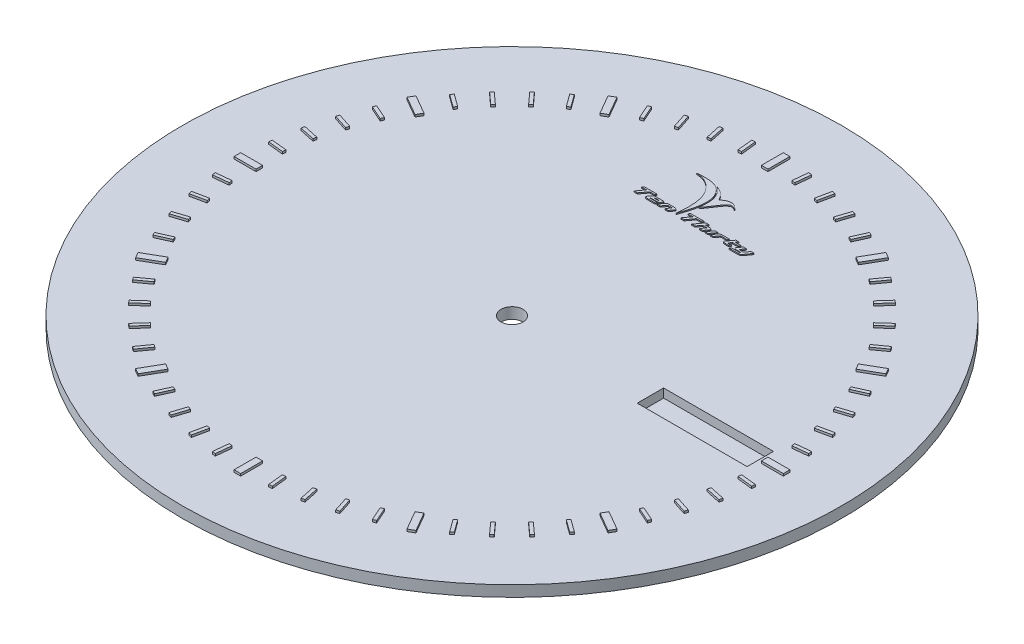
from build123d import *

# Parameters (mm, degrees)
SKETCH1_R         = 15
EXTRUDE1_DEPTH    = 0.5
SKETCH2_W         = 0.3
SKETCH2_H         = 1
EXTRUDE2_DEPTH    = 0.1
CIRPATTERN1_COUNT = 12
EXTRUDE3_DEPTH    = 0.1
CIRPATTERN2_COUNT = 60
SKETCH3_W         = 5
SKETCH3_H         = 1.2
EXTRUDE4_DEPTH    = 0.4
SKETCH4_R         = 0.5
EXTRUDE5_DEPTH    = 22.219095174
EXTRUDE6_DEPTH    = 0.05


# Read off the part's stored shape, not the designer's step: Extrude6
with BuildPart() as part:
    # Sketch1 → Extrude1 (new body)
    with BuildSketch(Plane(origin=(0, 0, 0), x_dir=(1, 0, 0), z_dir=(0, 1, 0))):
        with Locations(Location((0, 0, 0), (0, 0, 270))):
            Circle(SKETCH1_R)
    extrude(amount=EXTRUDE1_DEPTH)

    # Sketch2 → Extrude2 (add)
    with BuildSketch(Plane(origin=(0, 0.5, 0), x_dir=(1, 0, 0), z_dir=(0, 1, 0))):
        with Locations((0, 12)):
            Rectangle(SKETCH2_W, SKETCH2_H)
    extrude2 = extrude(amount=EXTRUDE2_DEPTH)

    # CirPattern1: Extrude2 ×12 about axis
    cirpattern1_axis = Axis((0, 0, 0), (0, 1, 0))
    for i in range(1, CIRPATTERN1_COUNT):
        add(extrude2.rotate(cirpattern1_axis, i * 360 / CIRPATTERN1_COUNT))

    # Sketch → Extrude3 (add)
    with BuildSketch(Plane(origin=(0, 0.5, 0), x_dir=(1, 0, 0), z_dir=(0, 1, 0))):
        Polygon((1.365515664, 12.274505773), (1.292345739, 11.578340446), (1.143167455, 11.594019716), (1.216337379, 12.290185043), align=None)
    extrude3 = extrude(amount=EXTRUDE3_DEPTH)

    # CirPattern2: Extrude3 ×60 about axis, 12 skipped
    cirpattern2_axis = Axis((0, 0, 0), (0, -1, 0))
    add([extrude3.rotate(cirpattern2_axis, i * 360 / CIRPATTERN2_COUNT) for i in range(1, CIRPATTERN2_COUNT) if i not in (4, 9, 14, 19, 24, 29, 34, 39, 44, 49, 54, 59)])

    # Sketch3 → Extrude4 (cut)
    with BuildSketch(Plane(origin=(0, 0.5, 0), x_dir=(1, 0, 0), z_dir=(0, 1, 0))):
        with Locations((8.8, 0)):
            Rectangle(SKETCH3_W, SKETCH3_H)
    extrude(amount=-EXTRUDE4_DEPTH, mode=Mode.SUBTRACT)

    # Sketch4 → Extrude5 (cut, through all)
    with BuildSketch(Plane(origin=(0, 0.5, 0), x_dir=(1, 0, 0), z_dir=(0, 1, 0))):
        with Locations(Location((0, 0, 0), (0, 0, 270))):
            Circle(SKETCH4_R)
    extrude(amount=-EXTRUDE5_DEPTH, mode=Mode.SUBTRACT)

    # Extrude6 outline → Extrude6 (add)
    # profile 1 of 11: a face of its own
    with BuildSketch(Plane(origin=(0, 0.5, 0), x_dir=(1, 0, 0), z_dir=(0, 1, 0))):
        with BuildLine():
            Line((-1.090122481, 7.719047483), (-1.422168481, 7.719047483))
            add(Edge.make_bspline(
                [(-1.422168481, 7.719047483), (-1.436246281, 7.719047483), (-1.444743781, 7.719776783), (-1.447654381, 7.721232083)],
                knots=[0.842105263, 0.842105263, 0.842105263, 0.842105263, 0.894736842, 0.894736842, 0.894736842, 0.894736842], degree=3))
            Line((-1.447654381, 7.721232083), (-1.427992981, 7.746717983))
            Line((-1.427992981, 7.746717983), (-1.131629881, 7.746717983))
            add(Edge.make_bspline(
                [(-1.131629881, 7.746717983), (-1.090851781, 7.746717983), (-1.060996681, 7.758855383), (-1.042064581, 7.783126883)],
                knots=[0.052631579, 0.052631579, 0.052631579, 0.052631579, 0.105263158, 0.105263158, 0.105263158, 0.105263158], degree=3))
            Line((-1.042064581, 7.783126883), (-0.998372581, 7.851575483))
            Line((-0.998372581, 7.851575483), (-0.999101881, 7.850846183))
            add(Edge.make_bspline(
                [(-0.999101881, 7.850846183), (-0.989878381, 7.864438883), (-0.985264981, 7.875846983), (-0.985264981, 7.885070483)],
                knots=[0.210526316, 0.210526316, 0.210526316, 0.210526316, 0.263157895, 0.263157895, 0.263157895, 0.263157895], degree=3))
            add(Edge.make_bspline(
                [(-0.985264981, 7.885070483), (-0.985264981, 7.904487683), (-1.000801381, 7.914199583), (-1.031870881, 7.914199583)],
                knots=[0.263157895, 0.263157895, 0.263157895, 0.263157895, 0.315789474, 0.315789474, 0.315789474, 0.315789474], degree=3))
            Line((-1.031870881, 7.914199583), (-1.349350681, 7.914199583))
            add(Edge.make_bspline(
                [(-1.349350681, 7.914199583), (-1.383819181, 7.914199583), (-1.412096881, 7.910193383), (-1.434183781, 7.902184283)],
                knots=[0.368421053, 0.368421053, 0.368421053, 0.368421053, 0.421052632, 0.421052632, 0.421052632, 0.421052632], degree=3))
            add(Edge.make_bspline(
                [(-1.434183781, 7.902184283), (-1.456270681, 7.894171883), (-1.471925881, 7.882159883), (-1.481149381, 7.866138383)],
                knots=[0.421052632, 0.421052632, 0.421052632, 0.421052632, 0.473684211, 0.473684211, 0.473684211, 0.473684211], degree=3))
            Line((-1.481149381, 7.866138383), (-1.480423381, 7.866867683))
            Line((-1.480423381, 7.866867683), (-1.594015981, 7.715407583))
            add(Edge.make_bspline(
                [(-1.594015981, 7.715407583), (-1.597900081, 7.709583083), (-1.599843781, 7.703029283), (-1.599843781, 7.695746183)],
                knots=[0.578947368, 0.578947368, 0.578947368, 0.578947368, 0.631578947, 0.631578947, 0.631578947, 0.631578947], degree=3))
            add(Edge.make_bspline(
                [(-1.599843781, 7.695746183), (-1.599843781, 7.665161783), (-1.558095481, 7.649872883), (-1.474598881, 7.649872883)],
                knots=[0.631578947, 0.631578947, 0.631578947, 0.631578947, 0.684210526, 0.684210526, 0.684210526, 0.684210526], degree=3))
            Line((-1.474598881, 7.649872883), (-1.141823581, 7.649872883))
            Line((-1.141823581, 7.649872883), (-1.090122481, 7.719047483))
        make_face()
        with BuildLine():
            add(Edge.make_bspline(
                [(-1.142552881, 7.845750983), (-1.137695281, 7.845750983), (-1.134784681, 7.845991883), (-1.133814481, 7.846476983)],
                knots=[0.5, 0.5, 0.5, 0.5, 0.583333333, 0.583333333, 0.583333333, 0.583333333], degree=3))
            add(Edge.make_bspline(
                [(-1.133814481, 7.846476983), (-1.134784681, 7.845506783), (-1.135876981, 7.844658683), (-1.137091381, 7.843929383)],
                knots=[0.583333333, 0.583333333, 0.583333333, 0.583333333, 0.666666667, 0.666666667, 0.666666667, 0.666666667], degree=3))
            add(Edge.make_bspline(
                [(-1.137091381, 7.843929383), (-1.138302481, 7.843200083), (-1.139638981, 7.842107783), (-1.141094281, 7.840652483)],
                knots=[0.666666667, 0.666666667, 0.666666667, 0.666666667, 0.75, 0.75, 0.75, 0.75], degree=3))
            Line((-1.141094281, 7.840652483), (-1.144008181, 7.834098683))
            Line((-1.144008181, 7.834098683), (-1.142552881, 7.838467883))
            Line((-1.142552881, 7.838467883), (-1.159300381, 7.818080483))
            Line((-1.159300381, 7.818080483), (-1.376295181, 7.818080483))
            Line((-1.376295181, 7.818080483), (-1.361732281, 7.833369383))
            Line((-1.361732281, 7.833369383), (-1.363187581, 7.832643383))
            add(Edge.make_bspline(
                [(-1.363187581, 7.832643383), (-1.352508781, 7.841381783), (-1.335757981, 7.845750983), (-1.312941781, 7.845750983)],
                knots=[0.333333333, 0.333333333, 0.333333333, 0.333333333, 0.416666667, 0.416666667, 0.416666667, 0.416666667], degree=3))
            Line((-1.312941781, 7.845750983), (-1.142552881, 7.845750983))
        make_face(mode=Mode.SUBTRACT)
    # profile 2 of 11: a face of its own
    with BuildSketch(Plane(origin=(0, 0.5, 0), x_dir=(1, 0, 0), z_dir=(0, 1, 0))):
        with BuildLine():
            Line((-0.508167481, 7.703029283), (-0.398940781, 7.853760083))
            add(Edge.make_bspline(
                [(-0.398940781, 7.853760083), (-0.401854681, 7.894053083), (-0.452341381, 7.914199583), (-0.550400881, 7.914199583)],
                knots=[0.352941176, 0.352941176, 0.352941176, 0.352941176, 0.411764706, 0.411764706, 0.411764706, 0.411764706], degree=3))
            Line((-0.550400881, 7.914199583), (-0.847496581, 7.914199583))
            Line((-0.847496581, 7.914199583), (-0.883176181, 7.866867683))
            Line((-0.883176181, 7.866867683), (-0.995313481, 7.717592183))
            Line((-0.995313481, 7.717592183), (-0.995313481, 7.718321483))
            Line((-0.995313481, 7.718321483), (-1.048469881, 7.650598883))
            Line((-1.048469881, 7.650598883), (-0.903563581, 7.650598883))
            Line((-0.903563581, 7.650598883), (-0.853321081, 7.716862883))
            Line((-0.853321081, 7.716862883), (-0.763755781, 7.834827983))
            Line((-0.763755781, 7.834827983), (-0.755746681, 7.845750983))
            Line((-0.755746681, 7.845750983), (-0.569332981, 7.845750983))
            add(Edge.make_bspline(
                [(-0.569332981, 7.845750983), (-0.560594581, 7.845750983), (-0.554770081, 7.844292383), (-0.551856181, 7.841381783)],
                knots=[0.058823529, 0.058823529, 0.058823529, 0.058823529, 0.117647059, 0.117647059, 0.117647059, 0.117647059], degree=3))
            Line((-0.551856181, 7.841381783), (-0.693122581, 7.650598883))
            Line((-0.693122581, 7.650598883), (-0.545305681, 7.650598883))
            Line((-0.545305681, 7.650598883), (-0.508167481, 7.703029283))
        make_face()
    # profile 3 of 11: a face of its own
    with BuildSketch(Plane(origin=(0, 0.5, 0), x_dir=(1, 0, 0), z_dir=(0, 1, 0))):
        with BuildLine():
            add(Edge.make_bspline(
                [(-0.038504881, 9.184089083), (0.101830919, 8.717340383), (-0.117364981, 8.116133183), (-0.249011881, 7.721156183)],
                knots=[0.714285714, 0.714285714, 0.714285714, 0.714285714, 1, 1, 1, 1], degree=3))
            add(Edge.make_bspline(
                [(-0.554245381, 9.734763383), (-0.272666281, 9.647527883), (-0.107042581, 9.412046483), (-0.038504881, 9.184089083)],
                knots=[0.571428571, 0.571428571, 0.571428571, 0.571428571, 0.714285714, 0.714285714, 0.714285714, 0.714285714], degree=3))
            add(Edge.make_bspline(
                [(-1.360851181, 9.766809683), (-1.083674281, 9.808165283), (-0.785529181, 9.806412983), (-0.554245381, 9.734763383)],
                knots=[0.428571429, 0.428571429, 0.428571429, 0.428571429, 0.571428571, 0.571428571, 0.571428571, 0.571428571], degree=3))
            add(Edge.make_bspline(
                [(-0.507075181, 9.322382183), (-0.682324981, 9.544587683), (-0.918925081, 9.747118583), (-1.360851181, 9.766809683)],
                knots=[0.285714286, 0.285714286, 0.285714286, 0.285714286, 0.428571429, 0.428571429, 0.428571429, 0.428571429], degree=3))
            add(Edge.make_bspline(
                [(-0.214355281, 8.212651583), (-0.218057881, 8.652917783), (-0.281764381, 9.036691283), (-0.507075181, 9.322382183)],
                knots=[0.142857143, 0.142857143, 0.142857143, 0.142857143, 0.285714286, 0.285714286, 0.285714286, 0.285714286], degree=3))
            Line((-0.214355281, 8.212651583), (-0.249011881, 7.721156183))
        make_face()
    # profile 4 of 11: a face of its own
    with BuildSketch(Plane(origin=(0, 0.5, 0), x_dir=(1, 0, 0), z_dir=(0, 1, 0))):
        with BuildLine():
            add(Edge.make_bspline(
                [(0.978066719, 9.156989483), (0.843416819, 9.315105683), (0.720224519, 9.397628783), (0.599936219, 9.399410783)],
                knots=[0.428571429, 0.428571429, 0.428571429, 0.428571429, 0.571428571, 0.571428571, 0.571428571, 0.571428571], degree=3))
            add(Edge.make_bspline(
                [(0.599936219, 9.399410783), (0.385518719, 9.402588683), (0.209074319, 9.217003283), (0.201058619, 9.229945883)],
                knots=[0.571428571, 0.571428571, 0.571428571, 0.571428571, 0.714285714, 0.714285714, 0.714285714, 0.714285714], degree=3))
            add(Edge.make_bspline(
                [(0.201058619, 9.229945883), (0.030336419, 9.505749983), (-0.062809381, 9.583035983), (-0.359400181, 9.697935383)],
                knots=[0.714285714, 0.714285714, 0.714285714, 0.714285714, 1, 1, 1, 1], degree=3))
            add(Edge.make_bspline(
                [(-0.359400181, 9.697935383), (0.100933319, 9.365341583), (0.087545219, 8.922768683), (0.019644419, 8.489046383)],
                knots=[0, 0, 0, 0, 0.142857143, 0.142857143, 0.142857143, 0.142857143], degree=3))
            add(Edge.make_bspline(
                [(0.019644419, 8.489046383), (0.151809419, 8.545314683), (0.409902419, 9.062616083), (0.560643119, 9.193784483)],
                knots=[0.142857143, 0.142857143, 0.142857143, 0.142857143, 0.285714286, 0.285714286, 0.285714286, 0.285714286], degree=3))
            add(Edge.make_bspline(
                [(0.560643119, 9.193784483), (0.655719419, 9.276528683), (0.733424519, 9.357127883), (0.978066719, 9.156989483)],
                knots=[0.285714286, 0.285714286, 0.285714286, 0.285714286, 0.428571429, 0.428571429, 0.428571429, 0.428571429], degree=3))
        make_face()
    # profile 5 of 11: a face of its own
    with BuildSketch(Plane(origin=(0, 0.5, 0), x_dir=(1, 0, 0), z_dir=(0, 1, 0))):
        with BuildLine():
            Line((0.675255419, 7.650598883), (0.814333919, 7.838467883))
            add(Edge.make_bspline(
                [(0.814333919, 7.838467883), (0.820161719, 7.842351983), (0.827078519, 7.845384683), (0.835087619, 7.847569283)],
                knots=[0.85, 0.85, 0.85, 0.85, 0.9, 0.9, 0.9, 0.9], degree=3))
            add(Edge.make_bspline(
                [(0.835087619, 7.847569283), (0.843096719, 7.849753883), (0.852686519, 7.850846183), (0.863850419, 7.850846183)],
                knots=[0.9, 0.9, 0.9, 0.9, 1, 1, 1, 1], degree=3))
            Line((0.863850419, 7.850846183), (1.009486019, 7.850846183))
            add(Edge.make_bspline(
                [(1.009486019, 7.850846183), (1.018709519, 7.850846183), (1.024534019, 7.849390883), (1.026962819, 7.846476983)],
                knots=[0.05, 0.05, 0.05, 0.05, 0.1, 0.1, 0.1, 0.1], degree=3))
            Line((1.026962819, 7.846476983), (0.940308119, 7.730699783))
            Line((0.940308119, 7.730699783), (0.887151719, 7.650598883))
            Line((0.887151719, 7.650598883), (1.033513319, 7.650598883))
            Line((1.033513319, 7.650598883), (1.070651519, 7.704484583))
            Line((1.070651519, 7.704484583), (1.179878219, 7.858858583))
            add(Edge.make_bspline(
                [(1.179878219, 7.858858583), (1.176964319, 7.899633383), (1.126477619, 7.920024083), (1.028418119, 7.920024083)],
                knots=[0.35, 0.35, 0.35, 0.35, 0.4, 0.4, 0.4, 0.4], degree=3))
            Line((1.028418119, 7.920024083), (0.873318119, 7.920024083))
            Line((0.873318119, 7.920024083), (0.943951319, 8.019053783))
            Line((0.943951319, 8.019053783), (0.804869519, 8.019053783))
            Line((0.804869519, 8.019053783), (0.695642819, 7.871962883))
            Line((0.695642819, 7.871962883), (0.583505519, 7.719047483))
            Line((0.583505519, 7.719047483), (0.583505519, 7.719776783))
            Line((0.583505519, 7.719776783), (0.530349119, 7.650598883))
            Line((0.530349119, 7.650598883), (0.675255419, 7.650598883))
        make_face()
    # profile 6 of 11: a face of its own
    with BuildSketch(Plane(origin=(0, 0.5, 0), x_dir=(1, 0, 0), z_dir=(0, 1, 0))):
        with BuildLine():
            add(Edge.make_bspline(
                [(1.520953019, 7.860313883), (1.542310619, 7.895752583), (1.586487719, 7.913470283), (1.653477719, 7.913470283)],
                knots=[0.615384615, 0.615384615, 0.615384615, 0.615384615, 0.692307692, 0.692307692, 0.692307692, 0.692307692], degree=3))
            Line((1.520953019, 7.860313883), (1.521679019, 7.861039883))
            Line((1.521679019, 7.861039883), (1.413910919, 7.717592183))
            Line((1.413910919, 7.717592183), (1.413910919, 7.718321483))
            Line((1.413910919, 7.718321483), (1.361480519, 7.650598883))
            Line((1.361480519, 7.650598883), (1.505660819, 7.650598883))
            Line((1.505660819, 7.650598883), (1.555174019, 7.716862883))
            Line((1.555174019, 7.716862883), (1.644739319, 7.834098683))
            add(Edge.make_bspline(
                [(1.693529819, 7.845750983), (1.672654019, 7.845750983), (1.656391619, 7.841866883), (1.644739319, 7.834098683)],
                knots=[0, 0, 0, 0, 0.076923077, 0.076923077, 0.076923077, 0.076923077], degree=3))
            Line((1.693529819, 7.845750983), (1.938921119, 7.845750983))
            Line((1.938921119, 7.845750983), (1.992806819, 7.913470283))
            Line((1.992806819, 7.913470283), (1.653477719, 7.913470283))
        make_face()
    # profile 7 of 11: a face of its own
    with BuildSketch(Plane(origin=(0, 0.5, 0), x_dir=(1, 0, 0), z_dir=(0, 1, 0))):
        with BuildLine():
            Line((2.261647919, 7.719047483), (2.113827719, 7.719047483))
            add(Edge.make_bspline(
                [(2.113827719, 7.719047483), (2.103148919, 7.719047483), (2.096110019, 7.720261883), (2.092711019, 7.722687383)],
                knots=[0.705882353, 0.705882353, 0.705882353, 0.705882353, 0.764705882, 0.764705882, 0.764705882, 0.764705882], degree=3))
            Line((2.092711019, 7.722687383), (2.178636419, 7.839197183))
            Line((2.178636419, 7.839197183), (2.177907119, 7.837738583))
            Line((2.177907119, 7.837738583), (2.190285419, 7.850846183))
            Line((2.190285419, 7.850846183), (2.450972219, 7.850846183))
            Line((2.450972219, 7.850846183), (2.499759419, 7.920024083))
            Line((2.499759419, 7.920024083), (2.236888019, 7.920024083))
            Line((2.236888019, 7.920024083), (2.306795219, 8.019053783))
            Line((2.306795219, 8.019053783), (2.168442719, 8.019053783))
            Line((2.168442719, 8.019053783), (2.059945319, 7.871962883))
            Line((2.059945319, 7.871962883), (1.946349419, 7.716136883))
            Line((1.946349419, 7.716136883), (1.946349419, 7.709583083))
            add(Edge.make_bspline(
                [(1.946349419, 7.709583083), (1.946349419, 7.670260283), (1.985428019, 7.650598883), (2.063585219, 7.650598883)],
                knots=[0.470588235, 0.470588235, 0.470588235, 0.470588235, 0.529411765, 0.529411765, 0.529411765, 0.529411765], degree=3))
            Line((2.063585219, 7.650598883), (2.192470019, 7.650598883))
            Line((2.192470019, 7.650598883), (2.261647919, 7.719047483))
        make_face()
    # profile 8 of 11: a face of its own
    with BuildSketch(Plane(origin=(0, 0.5, 0), x_dir=(1, 0, 0), z_dir=(0, 1, 0))):
        with BuildLine():
            add(Edge.make_bspline(
                [(2.608402019, 7.723416683), (2.610830819, 7.721476283), (2.619325019, 7.720502783), (2.633887919, 7.720502783)],
                knots=[0.785714286, 0.785714286, 0.785714286, 0.785714286, 0.821428571, 0.821428571, 0.821428571, 0.821428571], degree=3))
            Line((2.608402019, 7.723416683), (2.695782719, 7.839197183))
            Line((2.695782719, 7.839197183), (2.695782719, 7.838467883))
            Line((2.695782719, 7.838467883), (2.758406819, 7.920750083))
            Line((2.758406819, 7.920750083), (2.611315919, 7.920750083))
            Line((2.611315919, 7.920750083), (2.575636319, 7.871962883))
            Line((2.575636319, 7.871962883), (2.461314419, 7.716862883))
            add(Edge.make_bspline(
                [(2.455486619, 7.697201483), (2.455486619, 7.704484583), (2.457430319, 7.711038383), (2.461314419, 7.716862883)],
                knots=[0.535714286, 0.535714286, 0.535714286, 0.535714286, 0.571428571, 0.571428571, 0.571428571, 0.571428571], degree=3))
            add(Edge.make_bspline(
                [(2.581460819, 7.649872883), (2.497479119, 7.649872883), (2.455486619, 7.665650183), (2.455486619, 7.697201483)],
                knots=[0.5, 0.5, 0.5, 0.5, 0.535714286, 0.535714286, 0.535714286, 0.535714286], degree=3))
            Line((2.581460819, 7.649872883), (2.772240419, 7.650598883))
            Line((2.772240419, 7.650598883), (2.764960619, 7.639675883))
            add(Edge.make_bspline(
                [(2.735834819, 7.623657683), (2.747483819, 7.627056683), (2.757192419, 7.632396083), (2.764960619, 7.639675883)],
                knots=[0.357142857, 0.357142857, 0.357142857, 0.357142857, 0.392857143, 0.392857143, 0.392857143, 0.392857143], degree=3))
            add(Edge.make_bspline(
                [(2.695056719, 7.617833183), (2.710589819, 7.618318283), (2.724182519, 7.620258683), (2.735834819, 7.623657683)],
                knots=[0.321428571, 0.321428571, 0.321428571, 0.321428571, 0.357142857, 0.357142857, 0.357142857, 0.357142857], degree=3))
            Line((2.695056719, 7.617833183), (2.388496619, 7.617833183))
            Line((2.388496619, 7.617833183), (2.333881619, 7.550839883))
            Line((2.333881619, 7.550839883), (2.752582319, 7.550839883))
            add(Edge.make_bspline(
                [(2.877827219, 7.606180883), (2.849671619, 7.569286883), (2.807923319, 7.550839883), (2.752582319, 7.550839883)],
                knots=[0.178571429, 0.178571429, 0.178571429, 0.178571429, 0.214285714, 0.214285714, 0.214285714, 0.214285714], degree=3))
            Line((2.877827219, 7.606180883), (2.915691419, 7.656426683))
            Line((2.915691419, 7.656426683), (2.952829619, 7.705939883))
            Line((2.952829619, 7.705939883), (3.059868419, 7.855215383))
            Line((3.059868419, 7.855215383), (3.099920519, 7.920750083))
            Line((3.099920519, 7.920750083), (2.964478619, 7.920750083))
            Line((2.964478619, 7.920750083), (2.912777519, 7.851575483))
            Line((2.912777519, 7.851575483), (2.822486219, 7.720502783))
            Line((2.822486219, 7.720502783), (2.793360419, 7.719776783))
            Line((2.793360419, 7.719776783), (2.633887919, 7.720502783))
        make_face()
    # profile 9 of 11: a face of its own
    with BuildSketch(Plane(origin=(0, 0.5, 0), x_dir=(1, 0, 0), z_dir=(0, 1, 0))):
        Polygon((-2.083491781, 7.647688283), (-1.938585481, 7.647688283), (-1.698289381, 7.969540583), (-1.487119081, 7.969540583), (-1.430322781, 8.040899783), (-2.022326281, 8.040899783), (-2.075482681, 7.969540583), (-1.847564881, 7.969540583), align=None)
    # profile 10 of 11: a face of its own
    with BuildSketch(Plane(origin=(0, 0.5, 0), x_dir=(1, 0, 0), z_dir=(0, 1, 0))):
        Polygon((0.034319519, 7.647688283), (0.179225819, 7.647688283), (0.419521919, 7.969540583), (0.630692219, 7.969540583), (0.687488519, 8.040899783), (0.095485019, 8.040899783), (0.042328619, 7.969540583), (0.270246419, 7.969540583), align=None)
    # profile 11 of 11: a face of its own
    with BuildSketch(Plane(origin=(0, 0.5, 0), x_dir=(1, 0, 0), z_dir=(0, 1, 0))):
        Polygon((1.463278919, 7.914199583), (1.324926419, 7.914199583), (1.132691519, 7.650598883), (1.270314719, 7.650598883), align=None)
    extrude(amount=EXTRUDE6_DEPTH)


solid = part.part
